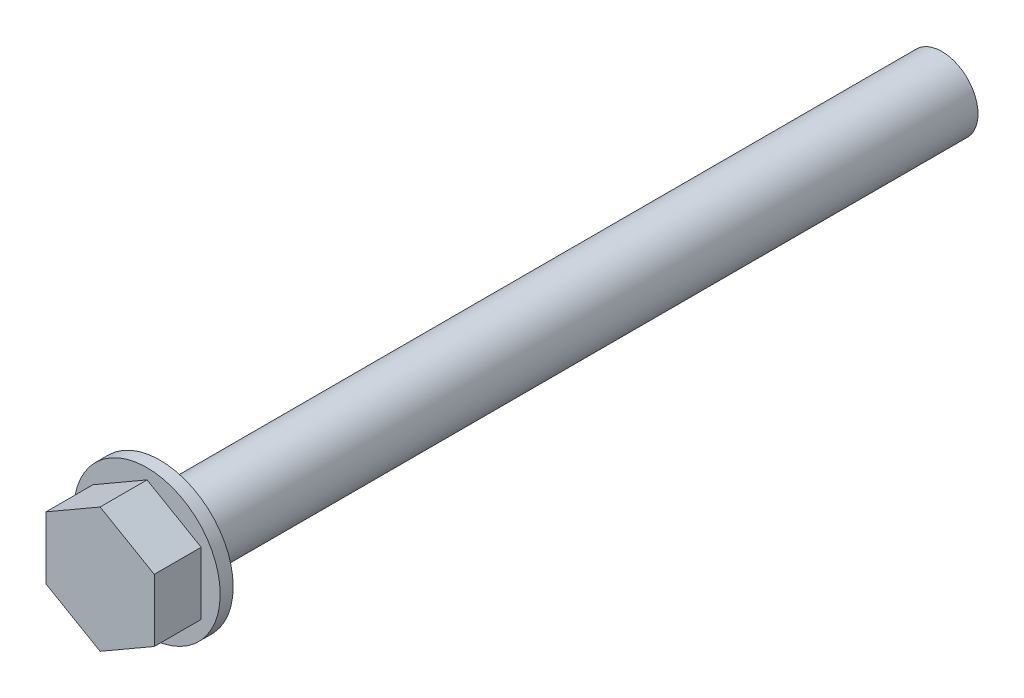
from build123d import *

# Parameters (mm, degrees)
EXTRUDE_SKETCH_1_R = 12.16
EXTRUDE_1_DEPTH    = 2.16
EXTRUDE_START      = 2.16
EXTRUDE_2_DEPTH    = 7.8
EXTRUDE_START_2    = -130
EXTRUDE_SKETCH_3_R = 6
EXTRUDE_3_DEPTH    = 130.01


with BuildPart() as part:
    # Extrude sketch 1 → Extrude 1 (new body)
    with BuildSketch(Plane.XY):
        Circle(EXTRUDE_SKETCH_1_R)
    extrude(amount=EXTRUDE_1_DEPTH)


with BuildPart() as body_2:
    # Extrude sketch 2 → Extrude 2 (new body)
    with BuildSketch(Plane.XY.offset(EXTRUDE_START)):
        Polygon((9, 5.196152423), (0, 10.392304845), (-9, 5.196152423), (-9, -5.196152423), (0, -10.392304845), (9, -5.196152423), align=None)
    extrude(amount=EXTRUDE_2_DEPTH)


with BuildPart() as body_3:
    # Extrude sketch 3 → Extrude 3 (new body)
    with BuildSketch(Plane.XY.offset(EXTRUDE_START_2)):
        Circle(EXTRUDE_SKETCH_3_R)
    extrude(amount=EXTRUDE_3_DEPTH)

    # Combine (weld / assembly of features): union body 2, part
    add(body_2.part)
    add(part.part)


solid = body_3.part
